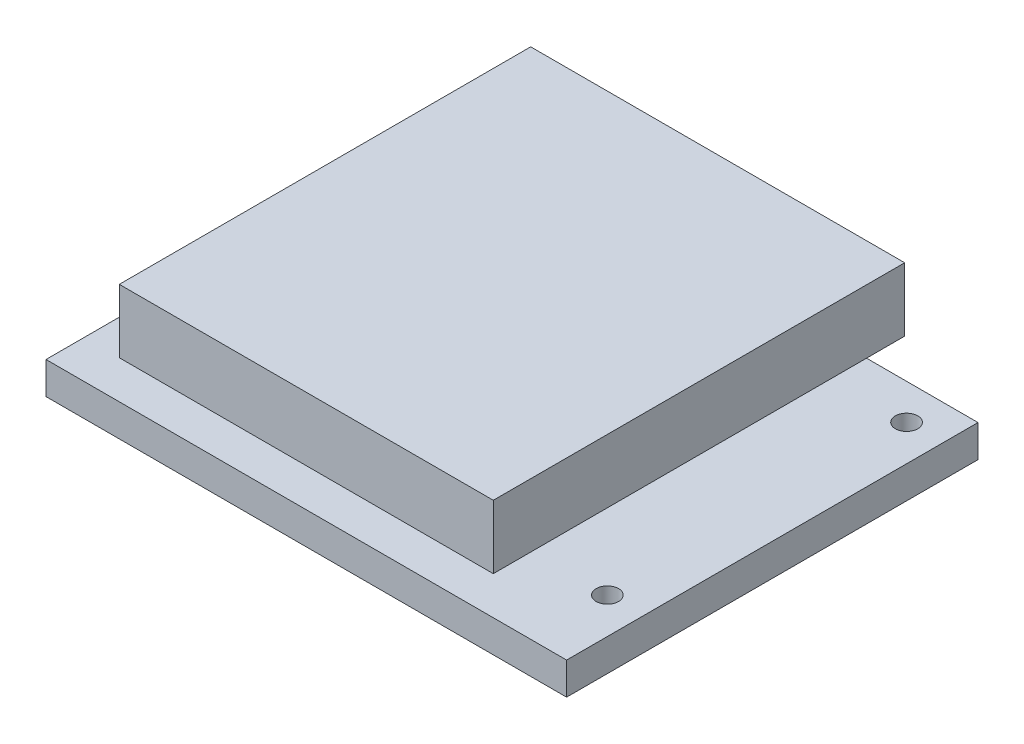
from build123d import *

# Parameters (mm, degrees)
SKETCH1_W           = 69.6
SKETCH1_H           = 55
SKETCH1_R           = 1.5
BOSS_EXTRUDE1_DEPTH = 4.3
SKETCH3_W           = 50
SKETCH3_H           = 55
BOSS_EXTRUDE2_DEPTH = 1.5
SKETCH5_W           = 50
SKETCH5_H           = 55
BOSS_EXTRUDE3_DEPTH = 7


with BuildPart() as part:
    # Sketch1 → Boss-Extrude1 (new body)
    with BuildSketch(Plane(origin=(0, 0, 0), x_dir=(1, 0, 0), z_dir=(0, 1, 0))):
        Rectangle(SKETCH1_W, SKETCH1_H)
        with Locations((30, 22.75)):
            Circle(SKETCH1_R, mode=Mode.SUBTRACT)
        with Locations((30, -17.25)):
            Circle(SKETCH1_R, mode=Mode.SUBTRACT)
        with Locations((-30, -17.25)):
            Circle(SKETCH1_R, mode=Mode.SUBTRACT)
        with Locations((-30, 22.75)):
            Circle(SKETCH1_R, mode=Mode.SUBTRACT)
    extrude(amount=BOSS_EXTRUDE1_DEPTH)


with BuildPart() as body_2:
    # Sketch3 → Boss-Extrude2 (new body)
    with BuildSketch(Plane(origin=(0, 9.4, 0), x_dir=(1, 0, 0), z_dir=(0, 1, 0))):
        Rectangle(SKETCH3_W, SKETCH3_H)
    extrude(amount=BOSS_EXTRUDE2_DEPTH)

    # Sketch5 → Boss-Extrude3 (add)
    with BuildSketch(Plane(origin=(0, 10.9, 0), x_dir=(1, 0, 0), z_dir=(0, 1, 0))):
        Rectangle(SKETCH5_W, SKETCH5_H)
    extrude(amount=BOSS_EXTRUDE3_DEPTH)


solid = Compound([part.part, body_2.part])
